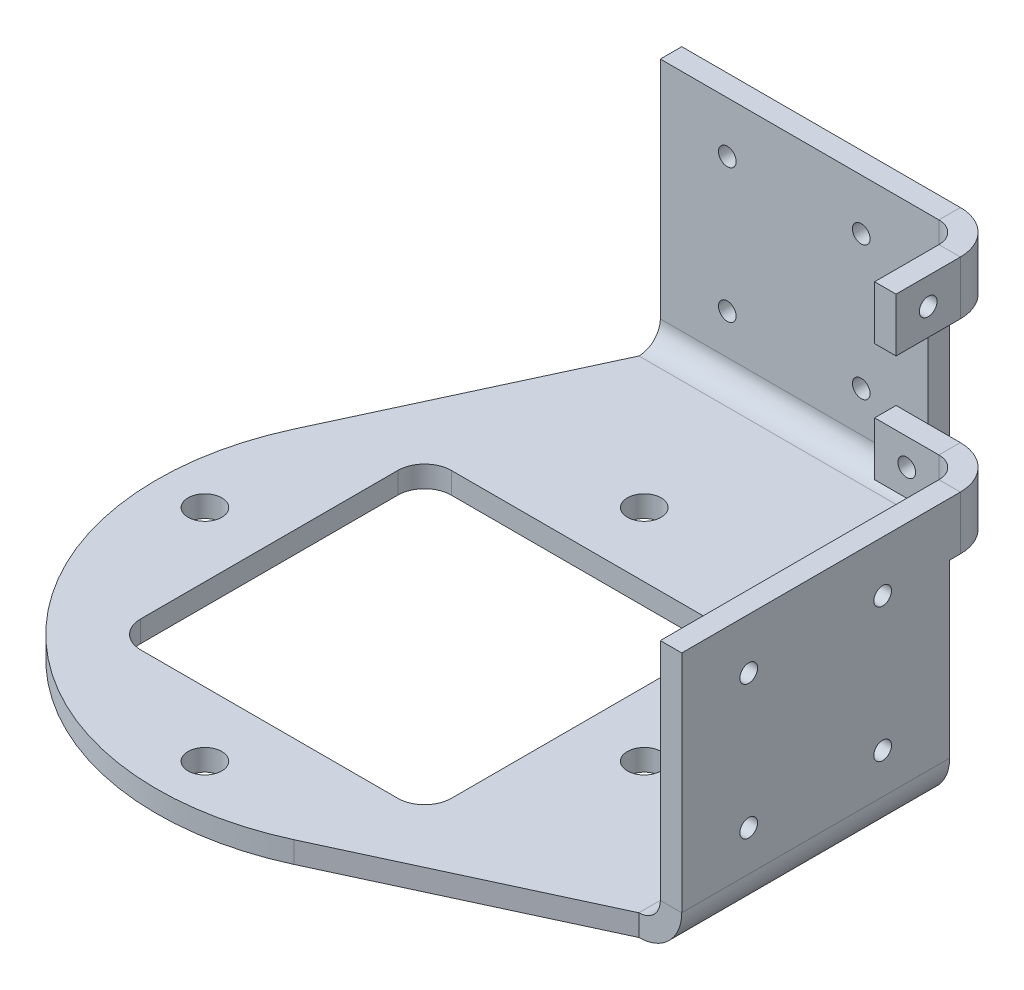
from build123d import *

# Parameters (mm, degrees)
SKETCH_1_R                         = 3.15
EXTRUDE_1_DEPTH                    = 4
SM_EDGE_FLANGE_1_DEPTH             = 50
SM_EDGE_FLANGE_1_BEND_DEPTH        = 50
SKETCH_25_W                        = 10
SKETCH_25_H                        = 10
EXTRUDE_3_DEPTH                    = 4
SKETCH_23_W                        = 10
SKETCH_23_H                        = 10
EXTRUDE_2_DEPTH                    = 4
SKETCH_21_R                        = 1.65
CUT_EXTRUDE_1_DEPTH                = 149.290255917
SKETCH_22_R                        = 1.65
CUT_EXTRUDE_2_DEPTH                = 149.290255917
SM_EDGE_FLANGE_2_STRIP_W           = 24
SM_EDGE_FLANGE_2_STRIP_H           = 4
SM_EDGE_FLANGE_2_STRIP_CUT_DEPTH   = 10
SM_EDGE_FLANGE_2_STRIP_2_W         = 24
SM_EDGE_FLANGE_2_STRIP_2_H         = 4
SM_EDGE_FLANGE_2_STRIP_CUT_2_DEPTH = 10
SM_EDGE_FLANGE_2_DEPTH             = 10
SM_EDGE_FLANGE_2_BEND_DEPTH        = 10
SKETCH_38_R                        = 1.65
CUT_EXTRUDE_3_DEPTH                = 4
SKETCH_37_R                        = 1.65
CUT_EXTRUDE_4_DEPTH                = 4


# Sheet-metal steps are written as plain solids
with BuildPart() as part:
    # Sketch 1 → 凸台-拉伸1 (new body)
    with BuildSketch(Plane(origin=(0, 0, 0), x_dir=(1, 0, 0), z_dir=(0, 1, 0))):
        with BuildLine():
            Line((-25, 65), (-45.371050591, 21.011134388))
            ThreePointArc((-45.371050591, 21.011134388), (-35.355339059, -35.355339059), (21.011134388, -45.371050591))
            Line((21.011134388, -45.371050591), (65, -25))
            Line((65, -25), (65, 25))
            Line((65, 25), (37.660706721, 37.660706721))
            Line((37.660706721, 37.660706721), (25, 65))
            Line((25, 65), (-25, 65))
        make_face()
        with Locations(Location((0, 41, 0), (0, 0, 270))):
            Circle(SKETCH_1_R, mode=Mode.SUBTRACT)
        with Locations(Location((0, -41, 0), (0, 0, 270))):
            Circle(SKETCH_1_R, mode=Mode.SUBTRACT)
        with Locations(Location((-41, 0, 0), (0, 0, 270))):
            Circle(SKETCH_1_R, mode=Mode.SUBTRACT)
        with BuildLine():
            ThreePointArc((29, -24), (27.535533906, -27.535533906), (24, -29))
            Line((24, -29), (-24, -29))
            ThreePointArc((-24, -29), (-27.535533906, -27.535533906), (-29, -24))
            Line((-29, -24), (-29, 24))
            ThreePointArc((-29, 24), (-27.535533906, 27.535533906), (-24, 29))
            Line((-24, 29), (24, 29))
            ThreePointArc((24, 29), (27.535533906, 27.535533906), (29, 24))
            Line((29, 24), (29, -24))
        make_face(mode=Mode.SUBTRACT)
        with Locations(Location((41, 0, 0), (0, 0, 270))):
            Circle(SKETCH_1_R, mode=Mode.SUBTRACT)
    extrude(amount=EXTRUDE_1_DEPTH)

    # 边线-法兰1 section (across the edge) → 边线-法兰1 (add)
    with BuildSketch(Plane(origin=(69, 4, 25), x_dir=(-1, 0, 0), z_dir=(0, 0, -1))):
        with BuildLine():
            Line((-4, 4), (-4, 46))
            Line((-4, 46), (0, 46))
            Line((0, 46), (0, 4))
            ThreePointArc((0, 4), (1.171572875, 1.171572875), (4, 0))
            Line((4, 0), (4, -4))
            ThreePointArc((4, -4), (-1.656854249, -1.656854249), (-4, 4))
        make_face()
    extrude(amount=SM_EDGE_FLANGE_1_DEPTH)

    # 边线-法兰1 section 2 (across the edge) → 边线-法兰1 bend (add)
    with BuildSketch(Plane(origin=(25, 4, -69), x_dir=(0, 0, 1), z_dir=(-1, 0, 0))):
        with BuildLine():
            Line((-4, 4), (-4, 46))
            Line((-4, 46), (0, 46))
            Line((0, 46), (0, 4))
            ThreePointArc((0, 4), (1.171572875, 1.171572875), (4, 0))
            Line((4, 0), (4, -4))
            ThreePointArc((4, -4), (-1.656854249, -1.656854249), (-4, 4))
        make_face()
    extrude(amount=SM_EDGE_FLANGE_1_BEND_DEPTH)

    # 草图25 → 凸台-拉伸3 (add)
    with BuildSketch(Plane.XY.offset(-69)):
        with Locations((30, 45)):
            Rectangle(SKETCH_25_W, SKETCH_25_H)
    extrude(amount=-EXTRUDE_3_DEPTH)

    # 草图23 → 凸台-拉伸2 (add)
    with BuildSketch(Plane.ZY.offset(-69)):
        with Locations((-30, 45)):
            Rectangle(SKETCH_23_W, SKETCH_23_H)
    extrude(amount=-EXTRUDE_2_DEPTH)

    # 草图21 → 切除-拉伸1 (cut, through all)
    with BuildSketch(Plane.XY.offset(-69)):
        with Locations((-12.5, 40.5)):
            Circle(SKETCH_21_R)
        with Locations(Location((12.5, 40.5, 0), (0, 0, 180))):
            Circle(SKETCH_21_R)
        with Locations((12.5, 15.5)):
            Circle(SKETCH_21_R)
        with Locations(Location((-12.5, 15.5, 0), (0, 0, 180))):
            Circle(SKETCH_21_R)
    extrude(amount=-CUT_EXTRUDE_1_DEPTH, mode=Mode.SUBTRACT)

    # 草图22 → 切除-拉伸2 (cut, through all)
    with BuildSketch(Plane.ZY.offset(-69)):
        with Locations(Location((-12.5, 40.5, 0), (0, 0, 270))):
            Circle(SKETCH_22_R)
        with Locations(Location((12.5, 40.5, 0), (0, 0, 90))):
            Circle(SKETCH_22_R)
        with Locations(Location((12.5, 15.5, 0), (0, 0, 270))):
            Circle(SKETCH_22_R)
        with Locations(Location((-12.5, 15.5, 0), (0, 0, 90))):
            Circle(SKETCH_22_R)
    extrude(amount=-CUT_EXTRUDE_2_DEPTH, mode=Mode.SUBTRACT)

    # 边线-法兰2 strip (across the edge) → 边线-法兰2 strip cut (cut)
    with BuildSketch(Plane(origin=(69, 50, -35), x_dir=(0, 0, 1), z_dir=(0, -1, 0))):
        with Locations((-4, -2)):
            Rectangle(SM_EDGE_FLANGE_2_STRIP_W, SM_EDGE_FLANGE_2_STRIP_H)
    extrude(amount=SM_EDGE_FLANGE_2_STRIP_CUT_DEPTH, mode=Mode.SUBTRACT)

    # 边线-法兰2 strip 2 (across the edge) → 边线-法兰2 strip cut 2 (cut)
    with BuildSketch(Plane(origin=(35, 40, -69), x_dir=(-1, 0, 0), z_dir=(0, 1, 0))):
        with Locations((-4, -2)):
            Rectangle(SM_EDGE_FLANGE_2_STRIP_2_W, SM_EDGE_FLANGE_2_STRIP_2_H)
    extrude(amount=SM_EDGE_FLANGE_2_STRIP_CUT_2_DEPTH, mode=Mode.SUBTRACT)

    # 边线-法兰2 section (across the edge) → 边线-法兰2 (add)
    with BuildSketch(Plane(origin=(69, 50, -35), x_dir=(0, 0, 1), z_dir=(0, -1, 0))):
        with BuildLine():
            Line((0, 4), (0, 16))
            Line((0, 16), (4, 16))
            Line((4, 16), (4, 4))
            ThreePointArc((4, 4), (5.171572875, 1.171572875), (8, 0))
            Line((8, 0), (8, -4))
            ThreePointArc((8, -4), (2.343145751, -1.656854249), (0, 4))
        make_face()
    extrude(amount=SM_EDGE_FLANGE_2_DEPTH)

    # 边线-法兰2 section 2 (across the edge) → 边线-法兰2 bend (add)
    with BuildSketch(Plane(origin=(35, 40, -69), x_dir=(-1, 0, 0), z_dir=(0, 1, 0))):
        with BuildLine():
            Line((0, 4), (0, 16))
            Line((0, 16), (4, 16))
            Line((4, 16), (4, 4))
            ThreePointArc((4, 4), (5.171572875, 1.171572875), (8, 0))
            Line((8, 0), (8, -4))
            ThreePointArc((8, -4), (2.343145751, -1.656854249), (0, 4))
        make_face()
    extrude(amount=SM_EDGE_FLANGE_2_BEND_DEPTH)

    # 草图38 → 切除-拉伸3 (cut)
    with BuildSketch(Plane(origin=(0, 0, -35), x_dir=(-1, 0, 0), z_dir=(0, 0, -1))):
        with Locations((-59, 45)):
            Circle(SKETCH_38_R)
    extrude(amount=-CUT_EXTRUDE_3_DEPTH, mode=Mode.SUBTRACT)

    # 草图37 → 切除-拉伸4 (cut)
    with BuildSketch(Plane(origin=(35, 0, 0), x_dir=(0, 0, -1), z_dir=(1, 0, 0))):
        with Locations((59, 45)):
            Circle(SKETCH_37_R)
    extrude(amount=-CUT_EXTRUDE_4_DEPTH, mode=Mode.SUBTRACT)


solid = part.part
